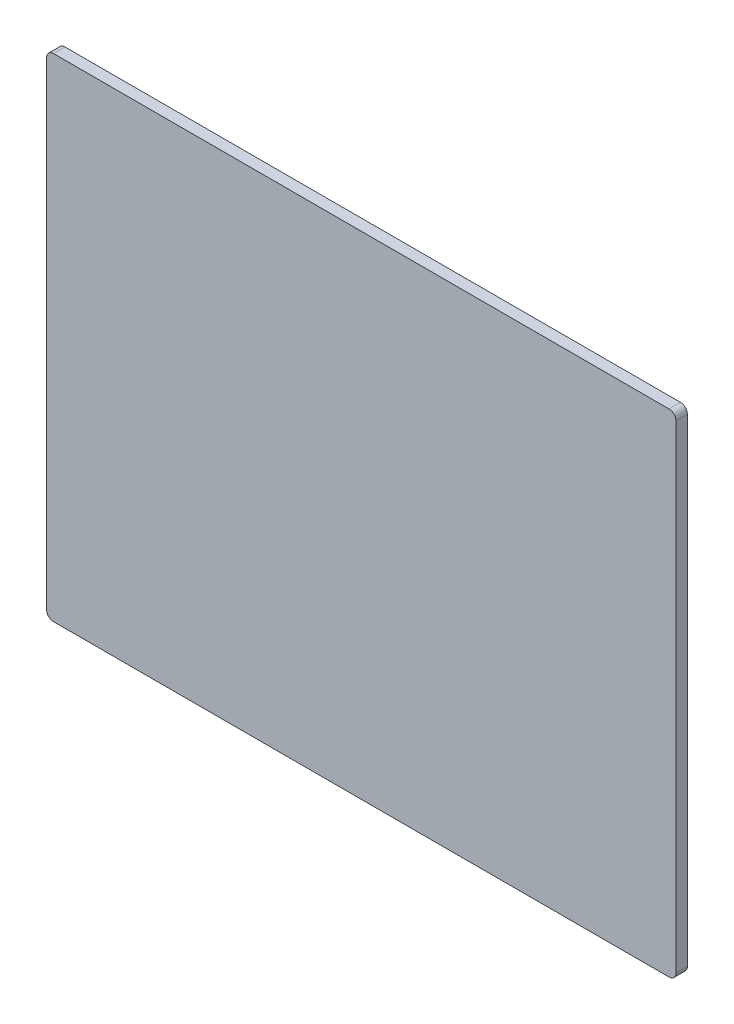
from build123d import *

# Parameters (mm, degrees)
CONVERT_SOLID1_START = -5
CONVERT_SOLID1_DEPTH = 5


# Read off the part's stored shape, not the designer's step: Convert-Solid1
with BuildPart() as part:
    # Convert-Solid1 outline → Convert-Solid1 (new body)
    with BuildSketch(Plane.XY.offset(CONVERT_SOLID1_START)):
        with BuildLine():
            ThreePointArc((3, 215), (0.878679656, 214.121320344), (0, 212))
            Line((0, 212), (0, 3))
            ThreePointArc((0, 3), (0.878679656, 0.878679656), (3, 0))
            Line((3, 0), (272, 0))
            ThreePointArc((272, 0), (274.121320344, 0.878679656), (275, 3))
            Line((275, 3), (275, 212))
            ThreePointArc((275, 212), (274.121320344, 214.121320344), (272, 215))
            Line((272, 215), (3, 215))
        make_face()
    extrude(amount=CONVERT_SOLID1_DEPTH)


solid = part.part
